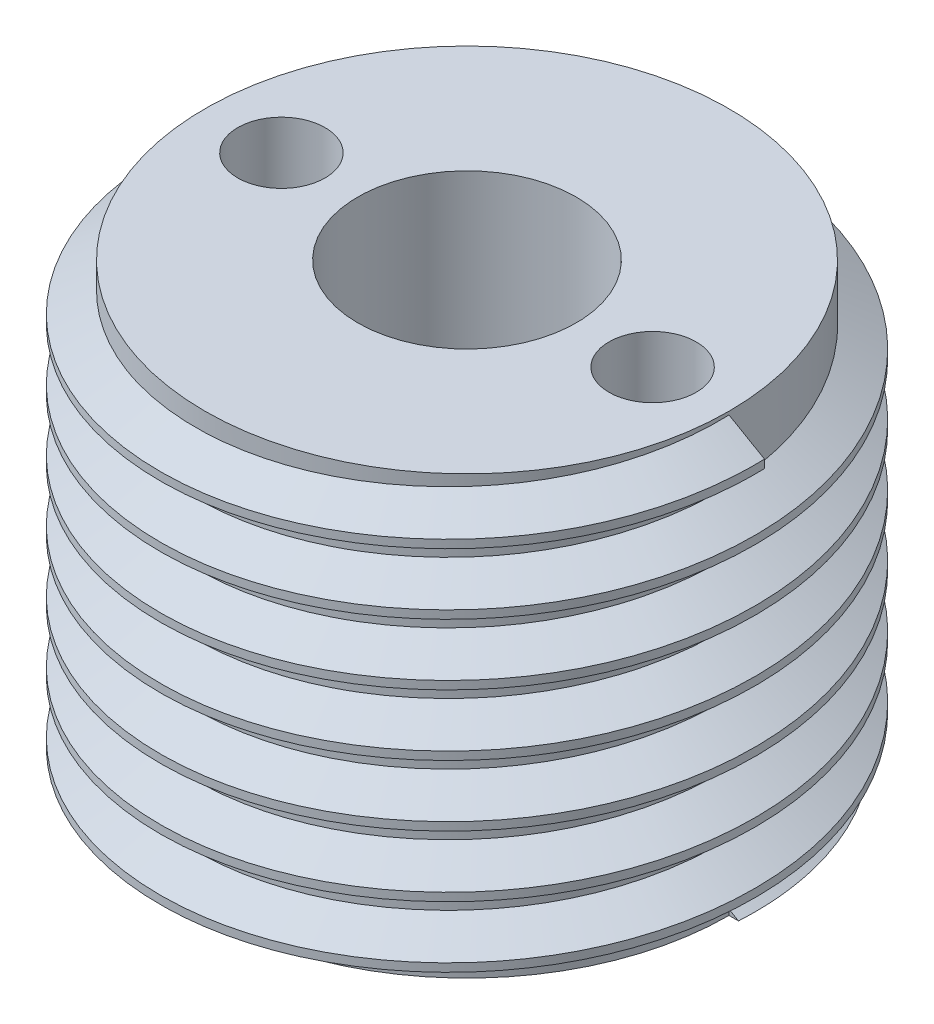
from build123d import *

# Parameters (mm, degrees)
ESQUISSE1_R             = 6
BOSS_EXTRU_1_DEPTH      = 10
FILETAGE1_PITCH         = 1.4
FILETAGE1_FROM          = 1
ESQUISSE23_R            = 2.5
ENL_V_MAT_EXTRU_1_DEPTH = 5.5
ESQUISSE24_R            = 1
ENL_V_MAT_EXTRU_2_DEPTH = 3


with BuildPart() as part:
    # Esquisse1 → Boss.-Extru.1 (new body)
    with BuildSketch(Plane(origin=(0, 0, 0), x_dir=(1, 0, 0), z_dir=(0, 1, 0))):
        with Locations(Location((0, 0, 0), (0, 0, 270))):
            Circle(ESQUISSE1_R)
    extrude(amount=BOSS_EXTRU_1_DEPTH)

    # Filetage1: arcs per turn and ends read off the stored shape
    # Filetage1: the profile of Profil de filetage2 profile screwed along a right-hand helix through 7 turns, 8 arcs to a turn; built about Z, then put on its axis
    filetage1_z = Axis((0, 0, 0), (0, 0, 1))
    filetage1_corners = [(5.9997, 0, -0.000173205), (6.811898812, 0, 0.468749998), (6.811898812, 0, 0.656249998), (5.9997, 0, 1.125173201)]
    with BuildLine(mode=Mode.PRIVATE) as filetage1_profile:
        Line(filetage1_corners[0], filetage1_corners[1])
        Line(filetage1_corners[1], filetage1_corners[2])
        Line(filetage1_corners[2], filetage1_corners[3])
        Line(filetage1_corners[3], filetage1_corners[0])
    filetage1_cap = Face(filetage1_profile.wire())
    filetage1_turn_angles = [0, 22.5, 45, 67.5, 90, 112.5, 135, 157.5, 180, 202.5, 225, 247.5, 270, 292.5, 315, 337.5, 360]
    filetage1_turn_weights = [1, 0.9238795325112867, 1, 0.9238795325112867, 1, 0.9238795325112867, 1, 0.9238795325112867, 1, 0.9238795325112867, 1, 0.9238795325112867, 1, 0.9238795325112867, 1, 0.9238795325112867, 1]
    filetage1_turn_rails = [Edge.make_bspline([Vector(p[0], p[1], 0).rotate(filetage1_z, filetage1_turn_angles[k]) / filetage1_turn_weights[k] + Vector(0, 0, p[2] + FILETAGE1_PITCH * filetage1_turn_angles[k] / 360) for k in range(17)], [0, 0, 0, 1, 1, 2, 2, 3, 3, 4, 4, 5, 5, 6, 6, 7, 7, 8, 8, 8], 2, filetage1_turn_weights) for p in filetage1_corners]
    filetage1_turn_sides = [Face.make_surface_from_curves(filetage1_turn_rails[p[0]], filetage1_turn_rails[p[1]]) for p in [(0, 1), (1, 2), (2, 3), (3, 0)]]
    filetage1 = Plane(origin=(0, -1, 0), x_dir=(1, 0, 0), z_dir=(0, 1, 0)) * split(Solid(Shell([*[p.moved(Location((0, 0, FILETAGE1_PITCH * i))) for i in range(7) for p in filetage1_turn_sides], filetage1_cap, filetage1_cap.rotate(filetage1_z, 2520).moved(Location((0, 0, FILETAGE1_PITCH * 2520 / 360)))])), bisect_by=Plane.XY.offset(FILETAGE1_FROM), keep=Keep.TOP, mode=Mode.PRIVATE)
    add(filetage1)

    # Esquisse23 → Enlèv. mat.-Extru.1 (cut)
    with BuildSketch(Plane(origin=(0, 10, 0), x_dir=(1, 0, 0), z_dir=(0, 1, 0))):
        with Locations(Location((0, 0, 0), (0, 0, 270))):
            Circle(ESQUISSE23_R)
    extrude(amount=-ENL_V_MAT_EXTRU_1_DEPTH, mode=Mode.SUBTRACT)

    # Esquisse24 → Enlèv. mat.-Extru.2 (cut)
    with BuildSketch(Plane(origin=(0, 10, 0), x_dir=(1, 0, 0), z_dir=(0, 1, 0))):
        with Locations(Location((4.25, 0, 0), (0, 0, 270))):
            Circle(ESQUISSE24_R)
        with Locations(Location((-4.25, 0, 0), (0, 0, 270))):
            Circle(ESQUISSE24_R)
    extrude(amount=-ENL_V_MAT_EXTRU_2_DEPTH, mode=Mode.SUBTRACT)


solid = part.part
